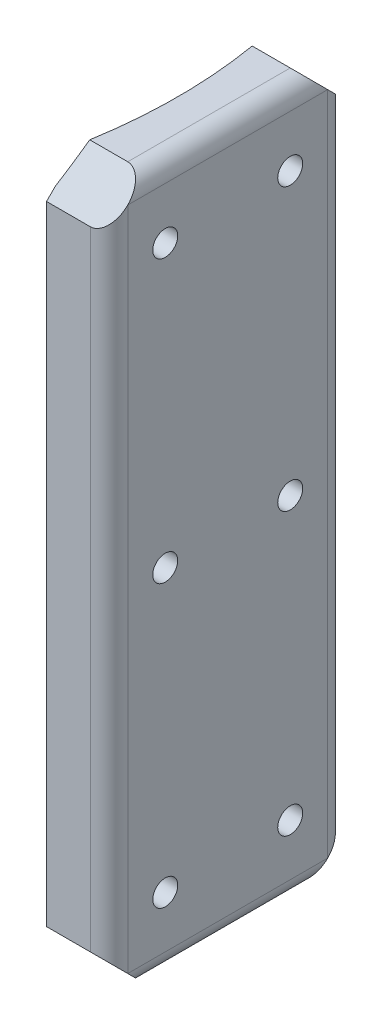
from build123d import *

# Parameters (mm, degrees)
BOSS_EXTRUDE1_DEPTH      = 8
BOSS_EXTRUDE1_DEPTH_BACK = 2
SKETCH2_W                = 38
SKETCH2_H                = 112.5
CUT_EXTRUDE1_START       = -2
CUT_EXTRUDE1_DEPTH       = 7
SKETCH3_3_R              = 2
CUT_EXTRUDE2_DEPTH       = 60.908784832
LPATTERN1_COUNT          = 2
LPATTERN1_PITCH          = 45
LPATTERN1_COL_COUNT      = 2
LPATTERN1_COL_PITCH      = 45
FILLET1_R                = 3
CHAMFER1_START           = 75
CHAMFER1_DEPTH           = 12
CUT_EXTRUDE3_DEPTH       = 105.74678766
CUT_EXTRUDE3_DEPTH_BACK  = 105.74678766
SKETCH1_R                = 78.2955


with BuildPart() as part:
    # Sketch2 → Boss-Extrude1 (new, two sides: drawn at the far end of the back side and taken through both)
    with BuildSketch(Plane(origin=(78.295, 0, 0), x_dir=(0, 0, -1), z_dir=(1, 0, 0)).offset(-BOSS_EXTRUDE1_DEPTH_BACK)):
        Rectangle(SKETCH2_W, SKETCH2_H)
    extrude(amount=BOSS_EXTRUDE1_DEPTH + BOSS_EXTRUDE1_DEPTH_BACK)

    # Sketch3 → Cut-Extrude1 (cut)
    with BuildSketch(Plane(origin=(78.295, 0, 0), x_dir=(0, 0, -1), z_dir=(1, 0, 0)).offset(CUT_EXTRUDE1_START)):
        with BuildLine():
            Line((-11.15, -7.65), (11.15, -7.65))
            ThreePointArc((11.15, -7.65), (13.978427125, -6.478427125), (15.15, -3.65))
            Line((15.15, -3.65), (15.15, 3.65))
            ThreePointArc((15.15, 3.65), (13.978427125, 6.478427125), (11.15, 7.65))
            Line((11.15, 7.65), (-11.15, 7.65))
            ThreePointArc((-11.15, 7.65), (-13.978427125, 6.478427125), (-15.15, 3.65))
            Line((-15.15, 3.65), (-15.15, -3.65))
            ThreePointArc((-15.15, -3.65), (-13.978427125, -6.478427125), (-11.15, -7.65))
        make_face()
    cut_extrude1 = extrude(amount=CUT_EXTRUDE1_DEPTH, mode=Mode.SUBTRACT)

    # Sketch3<3> → Cut-Extrude2 (cut, through all)
    with BuildSketch(Plane(origin=(78.295, 0, 0), x_dir=(0, 0, -1), z_dir=(1, 0, 0))):
        with Locations(Location((-10, 0, 0), (0, 0, 180))):
            Circle(SKETCH3_3_R)
        with Locations(Location((10, 0, 0), (0, 0, 180))):
            Circle(SKETCH3_3_R)
    cut_extrude2 = extrude(amount=CUT_EXTRUDE2_DEPTH, mode=Mode.SUBTRACT)

    # LPattern1: Cut-Extrude1, Cut-Extrude2 ×2
    with Locations(*[(0, -i * LPATTERN1_PITCH, 0) for i in range(1, LPATTERN1_COUNT)]):
        add(cut_extrude1, mode=Mode.SUBTRACT)
        add(cut_extrude2, mode=Mode.SUBTRACT)

    # LPattern1 col: Cut-Extrude1, Cut-Extrude2 ×2
    with Locations(*[(0, i * LPATTERN1_COL_PITCH, 0) for i in range(1, LPATTERN1_COL_COUNT)]):
        add(cut_extrude1, mode=Mode.SUBTRACT)
        add(cut_extrude2, mode=Mode.SUBTRACT)

    # Fillet1
    fillet1_edges = [part.edges().sort_by_distance(p)[0] for p in [
        (86.295, 0, -19),
        (86.295, 56.25, 0),
        (86.295, 0, 19),
        (86.295, -56.25, 0),
    ]]
    fillet(fillet1_edges, radius=FILLET1_R)

    # Chamfer1: read off the stored shape, not the designer's step
    # Chamfer1 outline → Chamfer1 (cut)
    with BuildSketch(Plane.YZ.offset(CHAMFER1_START)):
        Polygon((-56.25, 19), (-56.25, 13), (-50.25, 19), align=None)
        Polygon((-50.25, -19), (-56.25, -13), (-56.25, -19), align=None)
        Polygon((56.25, 19), (50.25, 19), (56.25, 13), align=None)
        Polygon((56.25, -13), (50.25, -19), (56.25, -19), align=None)
    extrude(amount=CHAMFER1_DEPTH, mode=Mode.SUBTRACT)

    # Sketch1 → Cut-Extrude3 (cut, two sides: drawn at the far end of the back side and taken through both)
    with BuildSketch(Plane(origin=(0, 0, 0), x_dir=(1, 0, 0), z_dir=(0, 1, 0)).offset(-CUT_EXTRUDE3_DEPTH_BACK)):
        Circle(SKETCH1_R)
    extrude(amount=CUT_EXTRUDE3_DEPTH + CUT_EXTRUDE3_DEPTH_BACK, mode=Mode.SUBTRACT)


solid = part.part
